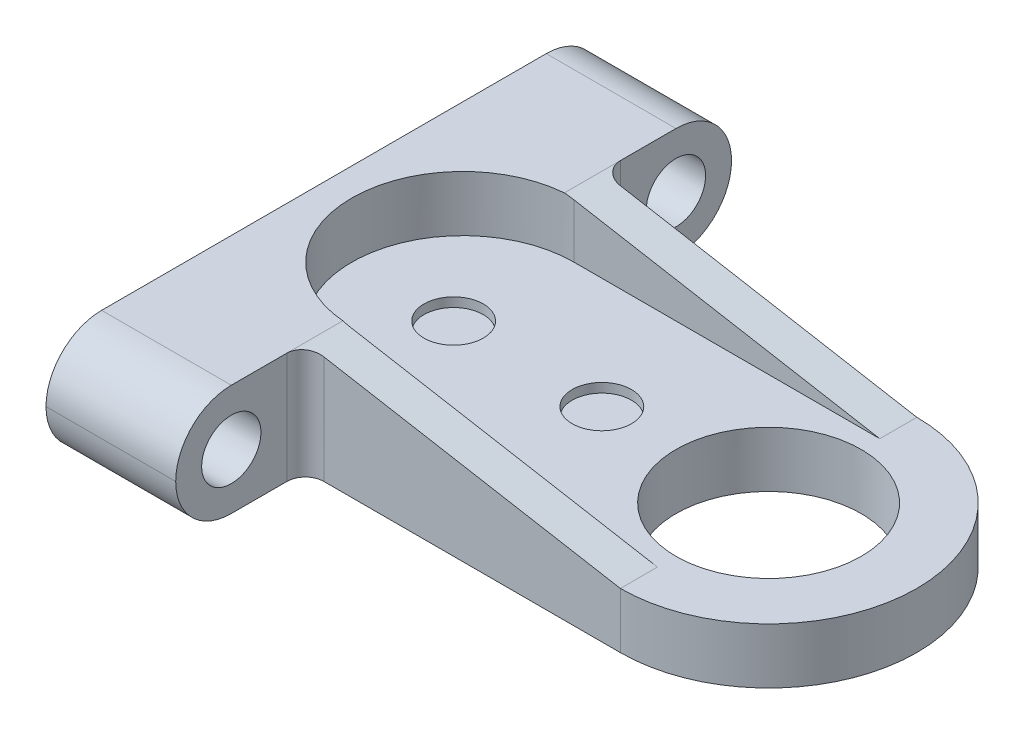
from build123d import *

# Parameters (mm, degrees)
SKETCH1_R               = 5
BOSS_EXTRUDE1_DEPTH     = 6
FILLET1_R               = 3
SKETCH2_R               = 1.6
CUT_EXTRUDE1_DEPTH      = 36.846896658
CUT_EXTRUDE2_DEPTH      = 29.930952283
CUT_EXTRUDE2_DEPTH_BACK = 29.930952283
CUT_EXTRUDE3_DEPTH      = 29.460498942
FILLET3_R               = 1
SKETCH5_R               = 1.6
CUT_EXTRUDE4_DEPTH      = 29.460498942
SKETCH6_R               = 3
CUT_EXTRUDE5_DEPTH      = 2
BOSS_EXTRUDE2_START     = -0.5
SKETCH7_R               = 1.6
BOSS_EXTRUDE2_DEPTH     = 0.5


with BuildPart() as part:
    # Sketch1 → Boss-Extrude1 (new body)
    with BuildSketch(Plane(origin=(0, 0, 0), x_dir=(1, 0, 0), z_dir=(0, 1, 0))):
        with BuildLine():
            Line((0, 8), (-17, 8))
            Line((-17, 8), (-17, 15))
            Line((-17, 15), (-24, 15))
            Line((-24, 15), (-24, -15))
            Line((-24, -15), (-17, -15))
            Line((-17, -15), (-17, -8))
            Line((-17, -8), (0, -8))
            ThreePointArc((0, -8), (8, 0), (0, 8))
        make_face()
        with Locations(Location((0, 0, 0), (0, 0, 270))):
            Circle(SKETCH1_R, mode=Mode.SUBTRACT)
    extrude(amount=BOSS_EXTRUDE1_DEPTH)

    # Fillet1
    fillet1_edges = [part.edges().sort_by_distance(p)[0] for p in [
        (-20.5, 0, -15),
        (-20.5, 6, -15),
        (-20.5, 0, 15),
        (-20.5, 6, 15),
    ]]
    fillet(fillet1_edges, radius=FILLET1_R - 0.0001)  # a hair under: the kernel refuses the full size

    # Sketch2 → Cut-Extrude1 (cut, through all)
    with BuildSketch(Plane.ZY.offset(24)):
        with Locations((-12, 3)):
            Circle(SKETCH2_R)
        with Locations((12, 3)):
            Circle(SKETCH2_R)
    extrude(amount=-CUT_EXTRUDE1_DEPTH, mode=Mode.SUBTRACT)

    # Sketch3 → Cut-Extrude2 (cut, two sides: drawn at the far end of the back side and taken through both)
    with BuildSketch(Plane.XY.offset(-CUT_EXTRUDE2_DEPTH_BACK)):
        Polygon((-17, 6), (8, 6), (8, 3), (0, 3), align=None)
    extrude(amount=CUT_EXTRUDE2_DEPTH + CUT_EXTRUDE2_DEPTH_BACK, mode=Mode.SUBTRACT)

    # Sketch4 → Cut-Extrude3 (cut, through all)
    with BuildSketch(Plane(origin=(0, 3, 0), x_dir=(1, 0, 0), z_dir=(0, 1, 0))):
        with BuildLine():
            Line((0, -6), (-16.5, -6))
            ThreePointArc((-16.5, -6), (-22.5, 0), (-16.5, 6))
            Line((-16.5, 6), (0, 6))
            ThreePointArc((0, 6), (6, 0), (0, -6))
        make_face()
    extrude(amount=CUT_EXTRUDE3_DEPTH, mode=Mode.SUBTRACT)

    # Fillet3
    fillet3_edges = [part.edges().sort_by_distance(p)[0] for p in [
        (-17, 3, -8),
        (-17, 3, 8),
    ]]
    fillet(fillet3_edges, radius=FILLET3_R)

    # Sketch5 → Cut-Extrude4 (cut, through all)
    with BuildSketch(Plane(origin=(0, 3, 0), x_dir=(1, 0, 0), z_dir=(0, 1, 0))):
        with Locations(Location((-9, 0, 0), (0, 0, 180))):
            Circle(SKETCH5_R)
        with Locations(Location((-17, 0, 0), (0, 0, 180))):
            Circle(SKETCH5_R)
    extrude(amount=-CUT_EXTRUDE4_DEPTH, mode=Mode.SUBTRACT)

    # Sketch6 → Cut-Extrude5 (cut)
    with BuildSketch(Plane.XZ):
        with Locations(Location((-17, 0, 0), (0, 0, 270))):
            Circle(SKETCH6_R)
        with Locations(Location((-9, 0, 0), (0, 0, 270))):
            Circle(SKETCH6_R)
    extrude(amount=-CUT_EXTRUDE5_DEPTH, mode=Mode.SUBTRACT)

    # Sketch7 → Boss-Extrude2 (add)
    with BuildSketch(Plane.XZ.offset(-2).offset(BOSS_EXTRUDE2_START)):
        with Locations(Location((-17, 0, 0), (0, 0, 180))):
            Circle(SKETCH7_R)
        with Locations(Location((-9, 0, 0), (0, 0, 180))):
            Circle(SKETCH7_R)
    extrude(amount=BOSS_EXTRUDE2_DEPTH)


solid = part.part
